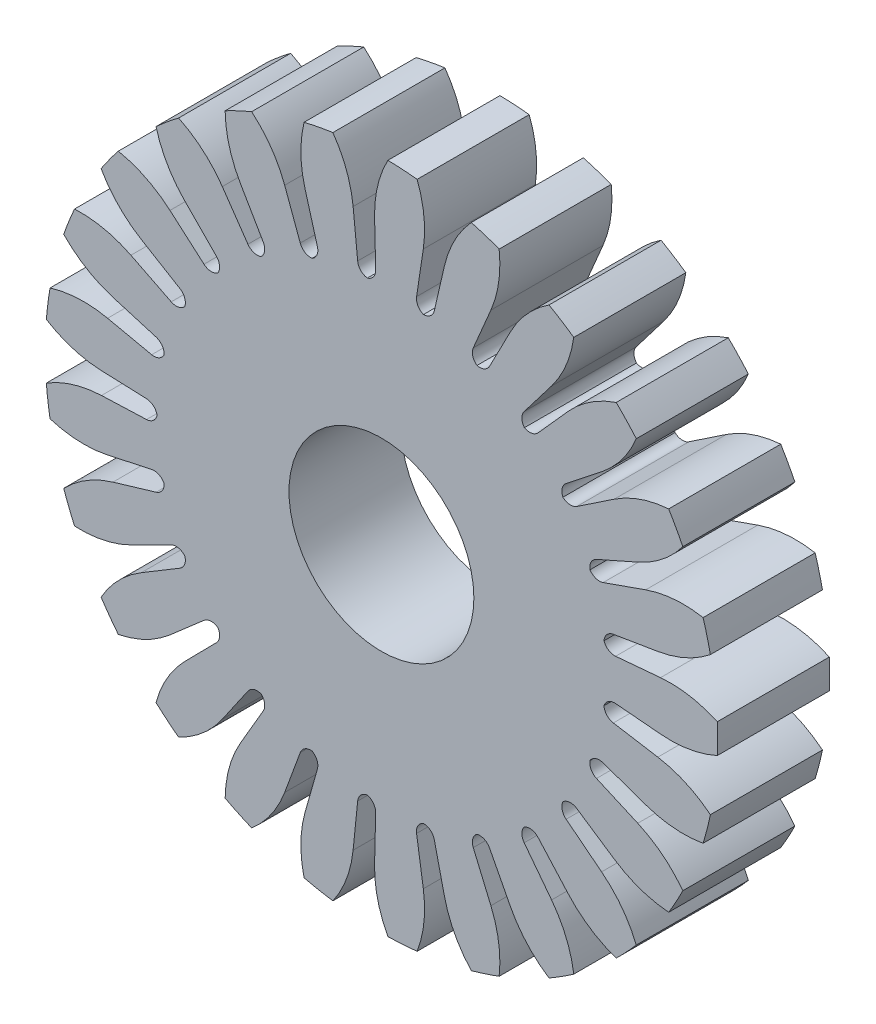
from build123d import *

# Parameters (mm, degrees)
BOSS_EXTRUDE1_DEPTH = 10
FILLET1_R           = 1
CIRPATTERN1_DEPTH   = 10
SKETCH2_R           = 8.25
CUT_EXTRUDE1_DEPTH  = 10


# Read off the part's stored shape, not the designer's step: CirPattern1
with BuildPart() as part:
    # Sketch1 → Boss-Extrude1 (new body)
    with BuildSketch(Plane.XY):
        with BuildLine():
            Line((19.69615506, 3.472963553), (0, 0))
            Line((0, 0), (19.69615506, -3.472963553))
            ThreePointArc((19.69615506, -3.472963553), (19.828897227, -2.610523844), (19.923893962, -1.743114855))
            Line((19.923893962, -1.743114855), (24.904867452, -2.178893569))
            ThreePointArc((24.904867452, -2.178893569), (27.494468767, -2.071560019), (29.971446647, -1.308581621))
            ThreePointArc((29.971446647, -1.308581621), (30, 0), (29.971446647, 1.308581621))
            ThreePointArc((29.971446647, 1.308581621), (27.494468767, 2.071560019), (24.904867452, 2.178893569))
            Line((24.904867452, 2.178893569), (19.923893962, 1.743114855))
            ThreePointArc((19.923893962, 1.743114855), (19.828897227, 2.610523844), (19.69615506, 3.472963553))
        make_face()
    extrude(amount=BOSS_EXTRUDE1_DEPTH)

    # Fillet1
    fillet1_edges = [part.edges().sort_by_distance(p)[0] for p in [
        (19.923893962, 1.743114855, 5),
        (19.923893962, -1.743114855, 5),
    ]]
    fillet(fillet1_edges, radius=FILLET1_R)

    # CirPattern1 outline → CirPattern1 (add)
    with BuildSketch(Plane.XY):
        with BuildLine():
            ThreePointArc((29.355269553, 6.186125562), (29.057494834, 7.460696615), (28.704407522, 8.721065808))
            ThreePointArc((28.704407522, 8.721065808), (26.115503444, 8.844074487), (23.580566449, 8.304028297))
            Line((23.580566449, 8.304028297), (19.785205389, 6.967470683))
            ThreePointArc((19.785205389, 6.967470683), (19.129029958, 6.964641157), (18.612366725, 7.369157296))
            ThreePointArc((18.612366725, 7.369157296), (18.71208766, 8.017717192), (19.192355907, 8.464837549))
            Line((19.192355907, 8.464837549), (22.873991696, 10.088632409))
            ThreePointArc((22.873991696, 10.088632409), (25.091568295, 11.430239463), (26.894592912, 13.292135725))
            ThreePointArc((26.894592912, 13.292135725), (26.289200401, 14.452610223), (25.633764904, 15.585573356))
            ThreePointArc((25.633764904, 15.585573356), (23.095604994, 15.060883229), (20.774611732, 13.907390388))
            Line((20.774611732, 13.907390388), (17.430877281, 11.668955275))
            ThreePointArc((17.430877281, 11.668955275), (16.796020482, 11.50303045), (16.194990102, 11.76634905))
            ThreePointArc((16.194990102, 11.76634905), (16.130287833, 12.419332832), (16.484273259, 12.971843937))
            Line((16.484273259, 12.971843937), (19.646422329, 15.460209884))
            ThreePointArc((19.646422329, 15.460209884), (21.460685575, 17.311156759), (22.744030086, 19.562952115))
            ThreePointArc((22.744030086, 19.562952115), (21.869058823, 20.536413178), (20.952458563, 21.470782011))
            ThreePointArc((20.952458563, 21.470782011), (18.624524742, 20.331361287), (16.663311756, 18.636899992))
            Line((16.663311756, 18.636899992), (13.981303048, 15.637236491))
            ThreePointArc((13.981303048, 15.637236491), (13.407655268, 15.318642034), (12.76002269, 15.424217819))
            ThreePointArc((12.76002269, 15.424217819), (12.534962699, 16.040596115), (12.740423097, 16.663781663))
            Line((12.740423097, 16.663781663), (15.184395993, 19.860365513))
            ThreePointArc((15.184395993, 19.860365513), (16.481349053, 22.10435041), (17.164376203, 24.604556276))
            ThreePointArc((17.164376203, 24.604556276), (16.074803849, 25.329837765), (14.954632193, 26.006902468))
            ThreePointArc((14.954632193, 26.006902468), (12.983197105, 24.324345142), (11.50499462, 22.195384628))
            Line((11.50499462, 22.195384628), (9.653232124, 18.622972629))
            ThreePointArc((9.653232124, 18.622972629), (9.176837764, 18.171727002), (8.523296124, 18.112926256))
            ThreePointArc((8.523296124, 18.112926256), (8.152019758, 18.65396975), (8.196045296, 19.308672702))
            Line((8.196045296, 19.308672702), (9.768278212, 23.012621336))
            ThreePointArc((9.768278212, 23.012621336), (10.466428756, 25.508646431), (10.506221438, 28.100165677))
            ThreePointArc((10.506221438, 28.100165677), (9.270509831, 28.531695489), (8.017151282, 28.908913596))
            ThreePointArc((8.017151282, 28.908913596), (6.526087445, 26.788940934), (5.623776359, 24.35925162))
            Line((5.623776359, 24.35925162), (4.718613124, 20.438558907))
            ThreePointArc((4.718613124, 20.438558907), (4.369405793, 19.883015531), (3.751019516, 19.663532922))
            ThreePointArc((3.751019516, 19.663532922), (3.256855434, 20.095245862), (3.136679826, 20.740328823))
            Line((3.136679826, 20.740328823), (3.738383586, 24.718909526))
            ThreePointArc((3.738383586, 24.718909526), (3.793864247, 27.310140383), (3.18792214, 29.830138324))
            ThreePointArc((3.18792214, 29.830138324), (1.883715586, 29.940801853), (0.575923272, 29.994471364))
            ThreePointArc((0.575923272, 29.994471364), (-0.341080291, 27.570289043), (-0.610804454, 24.992537245))
            Line((-0.610804454, 24.992537245), (-0.512493693, 20.96991536))
            ThreePointArc((-0.512493693, 20.96991536), (-0.712572013, 20.344981068), (-1.256947443, 19.978607496))
            ThreePointArc((-1.256947443, 19.978607496), (-1.842949094, 20.273863771), (-2.119774773, 20.868793806))
            Line((-2.119774773, 20.868793806), (-2.52640743, 24.872017721))
            ThreePointArc((-2.52640743, 24.872017721), (-3.117082705, 27.395637775), (-4.33068603, 29.685773672))
            ThreePointArc((-4.33068603, 29.685773672), (-5.621439438, 29.468617522), (-6.901492116, 29.195366183))
            ThreePointArc((-6.901492116, 29.195366183), (-7.186816698, 26.619294495), (-6.807006176, 24.055449838))
            Line((-6.807006176, 24.055449838), (-5.711398646, 20.18365491))
            ThreePointArc((-5.711398646, 20.18365491), (-5.7497763, 19.528596623), (-6.185935772, 19.038352686))
            ThreePointArc((-6.185935772, 19.038352686), (-6.826954353, 19.178600258), (-7.243036127, 19.685995724))
            Line((-7.243036127, 19.685995724), (-8.632454975, 23.462325569))
            ThreePointArc((-8.632454975, 23.462325569), (-9.832171887, 25.759766491), (-11.57718127, 27.676142684))
            ThreePointArc((-11.57718127, 27.676142684), (-12.773378747, 27.144811574), (-13.945261372, 26.561808773))
            ThreePointArc((-13.945261372, 26.561808773), (-13.58097898, 23.995711776), (-12.575498666, 21.606870049))
            Line((-12.575498666, 21.606870049), (-10.551435417, 18.129181191))
            ThreePointArc((-10.551435417, 18.129181191), (-10.425700995, 17.485158631), (-10.726239005, 16.901848158))
            ThreePointArc((-10.726239005, 16.901848158), (-11.381996962, 16.878274756), (-11.911190884, 17.266254131))
            Line((-11.911190884, 17.266254131), (-14.196093626, 20.578409213))
            ThreePointArc((-14.196093626, 20.578409213), (-15.929469549, 22.50531434), (-18.096239632, 23.927517865))
            ThreePointArc((-18.096239632, 23.927517865), (-19.122719692, 23.115397283), (-20.112798569, 22.259275229))
            ThreePointArc((-20.112798569, 22.259275229), (-19.121798405, 19.864390235), (-17.553826325, 17.80065115))
            Line((-17.553826325, 17.80065115), (-14.728486695, 14.935584343))
            ThreePointArc((-14.728486695, 14.935584343), (-14.446540554, 14.343063815), (-14.592573194, 13.70333835))
            ThreePointArc((-14.592573194, 13.70333835), (-15.221866842, 13.517425177), (-15.830921711, 13.761610291))
            Line((-15.830921711, 13.761610291), (-18.867739506, 16.401475725))
            ThreePointArc((-18.867739506, 16.401475725), (-21.025860055, 17.836770521), (-23.478244706, 18.675439099))
            ThreePointArc((-23.478244706, 18.675439099), (-24.270509831, 17.633557568), (-25.016574662, 16.558109559))
            ThreePointArc((-25.016574662, 16.558109559), (-23.461124912, 14.484916), (-21.429182518, 12.875951873))
            Line((-21.429182518, 12.875951873), (-17.980092987, 10.803529802))
            ThreePointArc((-17.980092987, 10.803529802), (-17.559650839, 10.29974155), (-17.542002342, 9.643797396))
            ThreePointArc((-17.542002342, 9.643797396), (-18.105290846, 9.307226061), (-18.755937505, 9.392273863))
            Line((-18.755937505, 9.392273863), (-22.353855921, 11.193977196))
            ThreePointArc((-22.353855921, 11.193977196), (-24.801118446, 12.047476811), (-27.385025317, 12.249913811))
            ThreePointArc((-27.385025317, 12.249913811), (-27.893294577, 11.04373658), (-28.348467365, 9.816536969))
            ThreePointArc((-28.348467365, 9.816536969), (-26.326302657, 8.195301221), (-23.958064362, 7.142209185))
            Line((-23.958064362, 7.142209185), (-20.10194391, 5.992649751))
            ThreePointArc((-20.10194391, 5.992649751), (-19.569423681, 5.609248644), (-19.389202967, 4.978301184))
            ThreePointArc((-19.389202967, 4.978301184), (-19.85109284, 4.512219702), (-20.502448765, 4.432786327))
            Line((-20.502448765, 4.432786327), (-24.435397357, 5.283119911))
            ThreePointArc((-24.435397357, 5.283119911), (-27.018031353, 5.501195826), (-29.571104073, 5.054681387))
            ThreePointArc((-29.571104073, 5.054681387), (-29.763441039, 3.759997007), (-29.899121605, 2.458155259))
            ThreePointArc((-29.899121605, 2.458155259), (-27.537301984, 1.390745526), (-24.98157291, 0.959695227))
            Line((-24.98157291, 0.959695227), (-20.960715768, 0.805229477))
            ThreePointArc((-20.960715768, 0.805229477), (-20.349577663, 0.566306016), (-20.018108661, 0))
            ThreePointArc((-20.018108661, 0), (-20.349577663, -0.566306016), (-20.960715768, -0.805229477))
            Line((-20.960715768, -0.805229477), (-24.98157291, -0.959695227))
            ThreePointArc((-24.98157291, -0.959695227), (-27.537301984, -1.390745526), (-29.899121605, -2.458155259))
            ThreePointArc((-29.899121605, -2.458155259), (-29.763441039, -3.759997007), (-29.571104073, -5.054681387))
            ThreePointArc((-29.571104073, -5.054681387), (-27.018031353, -5.501195826), (-24.435397357, -5.283119911))
            Line((-24.435397357, -5.283119911), (-20.502448765, -4.432786327))
            ThreePointArc((-20.502448765, -4.432786327), (-19.85109284, -4.512219702), (-19.389202967, -4.978301184))
            ThreePointArc((-19.389202967, -4.978301184), (-19.569423681, -5.609248644), (-20.10194391, -5.992649751))
            Line((-20.10194391, -5.992649751), (-23.958064362, -7.142209185))
            ThreePointArc((-23.958064362, -7.142209185), (-26.326302657, -8.195301221), (-28.348467365, -9.816536969))
            ThreePointArc((-28.348467365, -9.816536969), (-27.893294577, -11.04373658), (-27.385025317, -12.249913811))
            ThreePointArc((-27.385025317, -12.249913811), (-24.801118446, -12.047476811), (-22.353855921, -11.193977196))
            Line((-22.353855921, -11.193977196), (-18.755937505, -9.392273863))
            ThreePointArc((-18.755937505, -9.392273863), (-18.105290846, -9.307226061), (-17.542002342, -9.643797396))
            ThreePointArc((-17.542002342, -9.643797396), (-17.559650839, -10.29974155), (-17.980092987, -10.803529802))
            Line((-17.980092987, -10.803529802), (-21.429182518, -12.875951873))
            ThreePointArc((-21.429182518, -12.875951873), (-23.461124912, -14.484916), (-25.016574662, -16.558109559))
            ThreePointArc((-25.016574662, -16.558109559), (-24.270509831, -17.633557568), (-23.478244706, -18.675439099))
            ThreePointArc((-23.478244706, -18.675439099), (-21.025860055, -17.836770521), (-18.867739506, -16.401475725))
            Line((-18.867739506, -16.401475725), (-15.830921711, -13.761610291))
            ThreePointArc((-15.830921711, -13.761610291), (-15.221866842, -13.517425177), (-14.592573194, -13.70333835))
            ThreePointArc((-14.592573194, -13.70333835), (-14.446540554, -14.343063815), (-14.728486695, -14.935584343))
            Line((-14.728486695, -14.935584343), (-17.553826325, -17.80065115))
            ThreePointArc((-17.553826325, -17.80065115), (-19.121798405, -19.864390235), (-20.112798569, -22.259275229))
            ThreePointArc((-20.112798569, -22.259275229), (-19.122719692, -23.115397283), (-18.096239632, -23.927517865))
            ThreePointArc((-18.096239632, -23.927517865), (-15.929469549, -22.50531434), (-14.196093626, -20.578409213))
            Line((-14.196093626, -20.578409213), (-11.911190884, -17.266254131))
            ThreePointArc((-11.911190884, -17.266254131), (-11.381996962, -16.878274756), (-10.726239005, -16.901848158))
            ThreePointArc((-10.726239005, -16.901848158), (-10.425700995, -17.485158631), (-10.551435417, -18.129181191))
            Line((-10.551435417, -18.129181191), (-12.575498666, -21.606870049))
            ThreePointArc((-12.575498666, -21.606870049), (-13.58097898, -23.995711776), (-13.945261372, -26.561808773))
            ThreePointArc((-13.945261372, -26.561808773), (-12.773378747, -27.144811574), (-11.57718127, -27.676142684))
            ThreePointArc((-11.57718127, -27.676142684), (-9.832171887, -25.759766491), (-8.632454975, -23.462325569))
            Line((-8.632454975, -23.462325569), (-7.243036127, -19.685995724))
            ThreePointArc((-7.243036127, -19.685995724), (-6.826954353, -19.178600258), (-6.185935772, -19.038352686))
            ThreePointArc((-6.185935772, -19.038352686), (-5.7497763, -19.528596623), (-5.711398646, -20.18365491))
            Line((-5.711398646, -20.18365491), (-6.807006176, -24.055449838))
            ThreePointArc((-6.807006176, -24.055449838), (-7.186816698, -26.619294495), (-6.901492116, -29.195366183))
            ThreePointArc((-6.901492116, -29.195366183), (-5.621439438, -29.468617522), (-4.33068603, -29.685773672))
            ThreePointArc((-4.33068603, -29.685773672), (-3.117082705, -27.395637775), (-2.52640743, -24.872017721))
            Line((-2.52640743, -24.872017721), (-2.119774773, -20.868793806))
            ThreePointArc((-2.119774773, -20.868793806), (-1.842949094, -20.273863771), (-1.256947443, -19.978607496))
            ThreePointArc((-1.256947443, -19.978607496), (-0.712572013, -20.344981068), (-0.512493693, -20.96991536))
            Line((-0.512493693, -20.96991536), (-0.610804454, -24.992537245))
            ThreePointArc((-0.610804454, -24.992537245), (-0.341080291, -27.570289043), (0.575923272, -29.994471364))
            ThreePointArc((0.575923272, -29.994471364), (1.883715586, -29.940801853), (3.18792214, -29.830138324))
            ThreePointArc((3.18792214, -29.830138324), (3.793864247, -27.310140383), (3.738383586, -24.718909526))
            Line((3.738383586, -24.718909526), (3.136679826, -20.740328823))
            ThreePointArc((3.136679826, -20.740328823), (3.256855434, -20.095245862), (3.751019516, -19.663532922))
            ThreePointArc((3.751019516, -19.663532922), (4.369405793, -19.883015531), (4.718613124, -20.438558907))
            Line((4.718613124, -20.438558907), (5.623776359, -24.35925162))
            ThreePointArc((5.623776359, -24.35925162), (6.526087445, -26.788940934), (8.017151282, -28.908913596))
            ThreePointArc((8.017151282, -28.908913596), (9.270509831, -28.531695489), (10.506221438, -28.100165677))
            ThreePointArc((10.506221438, -28.100165677), (10.466428756, -25.508646431), (9.768278212, -23.012621336))
            Line((9.768278212, -23.012621336), (8.196045296, -19.308672702))
            ThreePointArc((8.196045296, -19.308672702), (8.152019758, -18.65396975), (8.523296124, -18.112926256))
            ThreePointArc((8.523296124, -18.112926256), (9.176837764, -18.171727002), (9.653232124, -18.622972629))
            Line((9.653232124, -18.622972629), (11.50499462, -22.195384628))
            ThreePointArc((11.50499462, -22.195384628), (12.983197105, -24.324345142), (14.954632193, -26.006902468))
            ThreePointArc((14.954632193, -26.006902468), (16.074803849, -25.329837765), (17.164376203, -24.604556276))
            ThreePointArc((17.164376203, -24.604556276), (16.481349053, -22.10435041), (15.184395993, -19.860365513))
            Line((15.184395993, -19.860365513), (12.740423097, -16.663781663))
            ThreePointArc((12.740423097, -16.663781663), (12.534962699, -16.040596115), (12.76002269, -15.424217819))
            ThreePointArc((12.76002269, -15.424217819), (13.407655268, -15.318642034), (13.981303048, -15.637236491))
            Line((13.981303048, -15.637236491), (16.663311756, -18.636899992))
            ThreePointArc((16.663311756, -18.636899992), (18.624524742, -20.331361287), (20.952458563, -21.470782011))
            ThreePointArc((20.952458563, -21.470782011), (21.869058823, -20.536413178), (22.744030086, -19.562952115))
            ThreePointArc((22.744030086, -19.562952115), (21.460685575, -17.311156759), (19.646422329, -15.460209884))
            Line((19.646422329, -15.460209884), (16.484273259, -12.971843937))
            ThreePointArc((16.484273259, -12.971843937), (16.130287833, -12.419332832), (16.194990102, -11.76634905))
            ThreePointArc((16.194990102, -11.76634905), (16.796020482, -11.50303045), (17.430877281, -11.668955275))
            Line((17.430877281, -11.668955275), (20.774611732, -13.907390388))
            ThreePointArc((20.774611732, -13.907390388), (23.095604994, -15.060883229), (25.633764904, -15.585573356))
            ThreePointArc((25.633764904, -15.585573356), (26.289200401, -14.452610223), (26.894592912, -13.292135725))
            ThreePointArc((26.894592912, -13.292135725), (25.091568295, -11.430239463), (22.873991696, -10.088632409))
            Line((22.873991696, -10.088632409), (19.192355907, -8.464837549))
            ThreePointArc((19.192355907, -8.464837549), (18.71208766, -8.017717192), (18.612366725, -7.369157296))
            ThreePointArc((18.612366725, -7.369157296), (19.129029958, -6.964641157), (19.785205389, -6.967470683))
            Line((19.785205389, -6.967470683), (23.580566449, -8.304028297))
            ThreePointArc((23.580566449, -8.304028297), (26.115503444, -8.844074487), (28.704407522, -8.721065808))
            ThreePointArc((28.704407522, -8.721065808), (29.057494834, -7.460696615), (29.355269553, -6.186125562))
            ThreePointArc((29.355269553, -6.186125562), (27.145855499, -4.831118183), (24.66430404, -4.083149056))
            Line((24.66430404, -4.083149056), (20.694512249, -3.425954287))
            ThreePointArc((20.694512249, -3.425954287), (20.118138201, -3.112318894), (19.860259895, -2.508934288))
            ThreePointArc((19.860259895, -2.508934288), (19.835061973, -2.598437517), (19.818286223, -2.689894268))
            ThreePointArc((19.818286223, -2.689894268), (19.761099839, -3.082033928), (19.69615506, -3.472963553))
            Line((19.69615506, -3.472963553), (0, 0))
            Line((0, 0), (19.69615506, 3.472963553))
            ThreePointArc((19.69615506, 3.472963553), (19.761099839, 3.082033928), (19.818286223, 2.689894268))
            ThreePointArc((19.818286223, 2.689894268), (19.835061973, 2.598437517), (19.860259895, 2.508934288))
            ThreePointArc((19.860259895, 2.508934288), (20.118138201, 3.112318894), (20.694512249, 3.425954287))
            Line((20.694512249, 3.425954287), (24.66430404, 4.083149056))
            ThreePointArc((24.66430404, 4.083149056), (27.145855499, 4.831118183), (29.355269553, 6.186125562))
        make_face()
    extrude(amount=CIRPATTERN1_DEPTH)

    # Sketch2 → Cut-Extrude1 (cut)
    with BuildSketch(Plane.XY.offset(10)):
        Circle(SKETCH2_R)
    extrude(amount=-CUT_EXTRUDE1_DEPTH, mode=Mode.SUBTRACT)


solid = part.part
